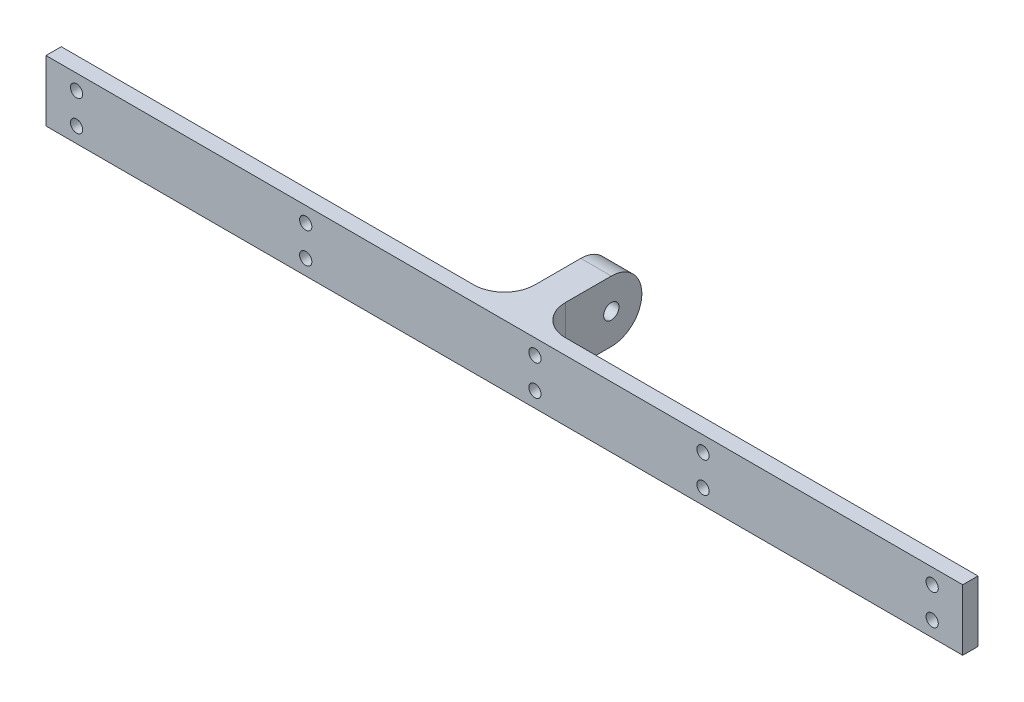
from build123d import *

# Parameters (mm, degrees)
ESQUISSE1_W             = 300
ESQUISSE1_H             = 20
BOSS_EXTRU_1_DEPTH      = 5
ESQUISSE2_R             = 2
ENL_V_MAT_EXTRU_1_DEPTH = 5
ESQUISSE3_W             = 10
ESQUISSE3_H             = 20
BOSS_EXTRU_2_DEPTH      = 35
CONG_1_R                = 10
CONG_2_R                = 10
ESQUISSE4_R             = 1.5
ENL_V_MAT_EXTRU_2_DEPTH = 35
ESQUISSE6_R             = 2.5
ENL_V_MAT_EXTRU_3_DEPTH = 5


# Some blends are built 0.0001 mm under size
with BuildPart() as part:
    # Esquisse1 → Boss.-Extru.1 (new body)
    with BuildSketch(Plane.XY):
        Rectangle(ESQUISSE1_W, ESQUISSE1_H)
    extrude(amount=BOSS_EXTRU_1_DEPTH)

    # Esquisse2 → Enlèv. mat.-Extru.1 (cut)
    with BuildSketch(Plane.XY.offset(5)):
        with Locations((-140, 5)):
            Circle(ESQUISSE2_R)
        with Locations((-140, -5)):
            Circle(ESQUISSE2_R)
        with Locations((-65, 5)):
            Circle(ESQUISSE2_R)
        with Locations((-65, -5)):
            Circle(ESQUISSE2_R)
        with Locations((10, 5)):
            Circle(ESQUISSE2_R)
        with Locations((10, -5)):
            Circle(ESQUISSE2_R)
        with Locations((65, 5)):
            Circle(ESQUISSE2_R)
        with Locations((65, -5)):
            Circle(ESQUISSE2_R)
        with Locations((140, 5)):
            Circle(ESQUISSE2_R)
        with Locations((140, -5)):
            Circle(ESQUISSE2_R)
    extrude(amount=-ENL_V_MAT_EXTRU_1_DEPTH, mode=Mode.SUBTRACT)

    # Esquisse3 → Boss.-Extru.2 (add)
    with BuildSketch(Plane(origin=(0, 0, 0), x_dir=(-1, 0, 0), z_dir=(0, 0, -1))):
        Rectangle(ESQUISSE3_W, ESQUISSE3_H)
    extrude(amount=BOSS_EXTRU_2_DEPTH)

    # Congé1
    # the kernel refuses this fillet: 10 mm, written as the material it adds along each edge
    with BuildSketch(Plane(origin=(5, 10, 0), x_dir=(1, 0, 0), z_dir=(0, -1, 0))) as cong_1_piece_1_section:
        with BuildLine():
            CenterArc((CONG_1_R, -CONG_1_R), CONG_1_R, 90, 90)
            Line((0, -CONG_1_R), (0, 0))
            Line((0, 0), (CONG_1_R, 0))
        make_face()
    cong_1_piece_1 = extrude(amount=20, mode=Mode.PRIVATE)
    cong_1_piece_1 = cong_1_piece_1 - Plane(origin=(10, -5, -2.39791943), x_dir=(1, 0, 0), z_dir=(0, 0, 1)) * Cylinder(2, 80, mode=Mode.PRIVATE)
    cong_1_piece_1 = cong_1_piece_1 - Plane(origin=(10, 5, -2.39791943), x_dir=(1, 0, 0), z_dir=(0, 0, 1)) * Cylinder(2, 80, mode=Mode.PRIVATE)
    add(cong_1_piece_1)
    with BuildSketch(Plane(origin=(-5, -10, 0), x_dir=(-1, 0, 0), z_dir=(0, 1, 0))) as cong_1_piece_2:
        with BuildLine():
            CenterArc((CONG_1_R, -CONG_1_R), CONG_1_R, 90, 90)
            Line((0, -CONG_1_R), (0, 0))
            Line((0, 0), (CONG_1_R, 0))
        make_face()
    extrude(amount=20)

    # Congé2
    cong_2_edges = [part.edges().sort_by_distance(p)[0] for p in [
        (0, -10, -35),
        (0, 10, -35),
    ]]
    fillet(cong_2_edges, radius=CONG_2_R - 0.0001)  # a hair under: the kernel refuses the full size

    # Esquisse4 → Enlèv. mat.-Extru.2 (cut)
    with BuildSketch(Plane.ZY.offset(5)):
        with Locations(Location((-25, 0, 0), (0, 0, 270))):
            Circle(ESQUISSE4_R)
    extrude(amount=-ENL_V_MAT_EXTRU_2_DEPTH, mode=Mode.SUBTRACT)

    # Esquisse6 → Enlèv. mat.-Extru.3 (cut)
    with BuildSketch(Plane(origin=(5, 0, 0), x_dir=(0, 0, -1), z_dir=(1, 0, 0))):
        with Locations(Location((25, 0, 0), (0, 0, 90))):
            Circle(ESQUISSE6_R)
    extrude(amount=-ENL_V_MAT_EXTRU_3_DEPTH, mode=Mode.SUBTRACT)


solid = part.part
